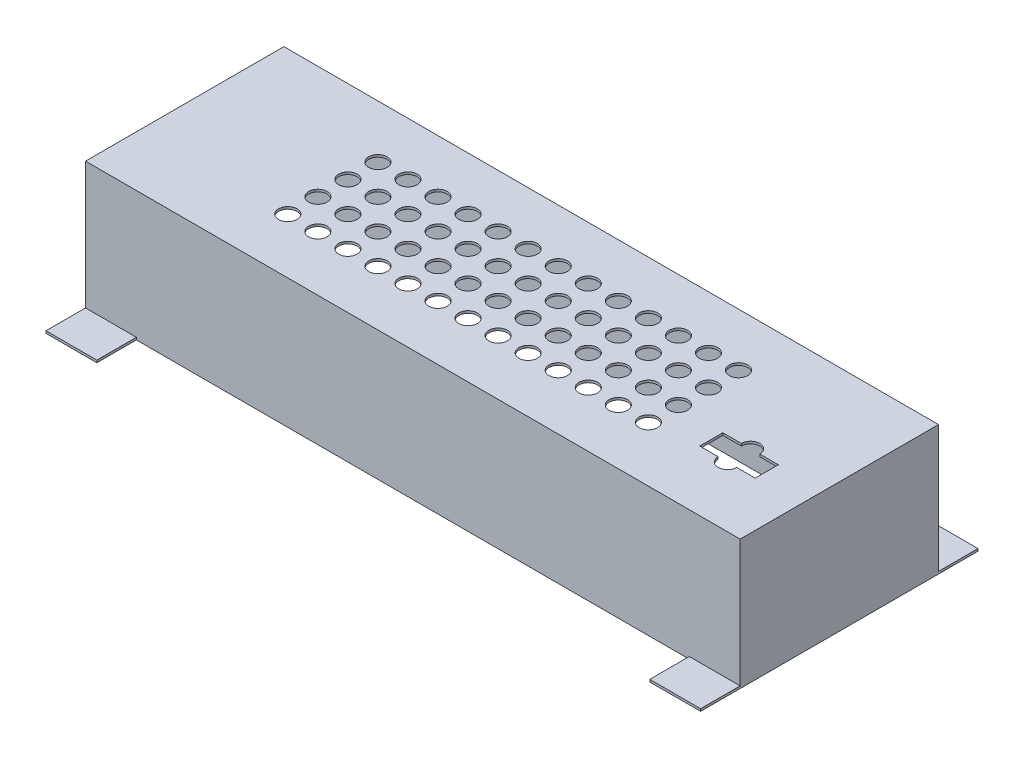
from build123d import *

# Parameters (mm, degrees)
SCHIZZO1_W                   = 141.6
SCHIZZO1_H                   = 42.9
ESTRUSIONE_ESTRUSIONE1_DEPTH = 28
SVUOTA1_T                    = -0.5
RIPETIZIONE_A_L1_COUNT       = 13
RIPETIZIONE_A_L1_PITCH       = 6.5
RIPETIZIONE_A_L1_COUNT_DIR2  = 4
RIPETIZIONE_A_L1_PITCH_DIR2  = 6.5
SCHIZZO4_W                   = 12
SCHIZZO4_H                   = 5
TAGLIO_ESTRUSIONE1_DEPTH     = 28
TAGLIO_ESTRUSIONE2_DEPTH     = 28
SCHIZZO8_W                   = 11
SCHIZZO8_H                   = 8.55
ESTRUSIONE_ESTRUSIONE2_DEPTH = 0.5
RIPETIZIONE_A_L2_COUNT       = 2
RIPETIZIONE_A_L2_PITCH       = 130.6


with BuildPart() as part:
    # Schizzo1 → Estrusione-Estrusione1 (new body)
    with BuildSketch(Plane(origin=(0, 0, 0), x_dir=(1, 0, 0), z_dir=(0, 1, 0))):
        Rectangle(SCHIZZO1_W, SCHIZZO1_H)
    extrude(amount=ESTRUSIONE_ESTRUSIONE1_DEPTH)

    # Svuota1
    svuota1_openings = [part.faces().sort_by_distance(p)[0] for p in [
        (0, 0, 0),
    ]]
    offset(amount=SVUOTA1_T, openings=svuota1_openings, kind=Kind.INTERSECTION)

    # Schizzo2 → Foro Ø4.0 (4)-1 (revolve, cut)
    with BuildSketch(Plane(origin=(-39, 28, -10), x_dir=(0, 0, 1), z_dir=(1, 0, 0))):
        Polygon((0, 0), (0, 7.201721238), (2, 6), (2, 0), align=None)
    foro_4_0_4_1 = revolve(axis=Axis((-39, 34.35, -10), (0, -1, 0)), mode=Mode.SUBTRACT)

    # Ripetizione a L1: Foro _4.0 _4_-1 13 × 4
    with Locations(*[(i * RIPETIZIONE_A_L1_PITCH, 0, j * RIPETIZIONE_A_L1_PITCH_DIR2) for i in range(RIPETIZIONE_A_L1_COUNT) for j in range(RIPETIZIONE_A_L1_COUNT_DIR2) if (i, j) != (0, 0)]):
        add(foro_4_0_4_1, mode=Mode.SUBTRACT)

    # Schizzo4 → Taglio-Estrusione1 (cut)
    with BuildSketch(Plane(origin=(0, 28, 0), x_dir=(1, 0, 0), z_dir=(0, 1, 0))):
        with Locations((55, -5.9)):
            Rectangle(SCHIZZO4_W, SCHIZZO4_H)
    extrude(amount=-TAGLIO_ESTRUSIONE1_DEPTH, mode=Mode.SUBTRACT)

    # Schizzo6 → Taglio-Estrusione2 (cut)
    with BuildSketch(Plane(origin=(0, 28, 0), x_dir=(1, 0, 0), z_dir=(0, 1, 0))):
        with BuildLine():
            Line((53, -3.4), (57, -3.4))
            ThreePointArc((57, -3.4), (55, -1.4), (53, -3.4))
        make_face()
        with BuildLine():
            Line((57, -8.4), (53, -8.4))
            ThreePointArc((53, -8.4), (55, -10.4), (57, -8.4))
        make_face()
    extrude(amount=-TAGLIO_ESTRUSIONE2_DEPTH, mode=Mode.SUBTRACT)

    # Schizzo8 → Estrusione-Estrusione2 (add)
    with BuildSketch(Plane(origin=(0, 0, 0), x_dir=(1, 0, 0), z_dir=(0, 1, 0))):
        with Locations((-65.3, 25.725)):
            Rectangle(SCHIZZO8_W, SCHIZZO8_H)
        with Locations((-65.3, -25.725)):
            Rectangle(SCHIZZO8_W, SCHIZZO8_H)
    estrusione_estrusione2 = extrude(amount=ESTRUSIONE_ESTRUSIONE2_DEPTH)

    # Ripetizione a L2: Estrusione-Estrusione2 ×2
    with Locations(*[(i * RIPETIZIONE_A_L2_PITCH, 0, 0) for i in range(1, RIPETIZIONE_A_L2_COUNT)]):
        add(estrusione_estrusione2)


solid = part.part
